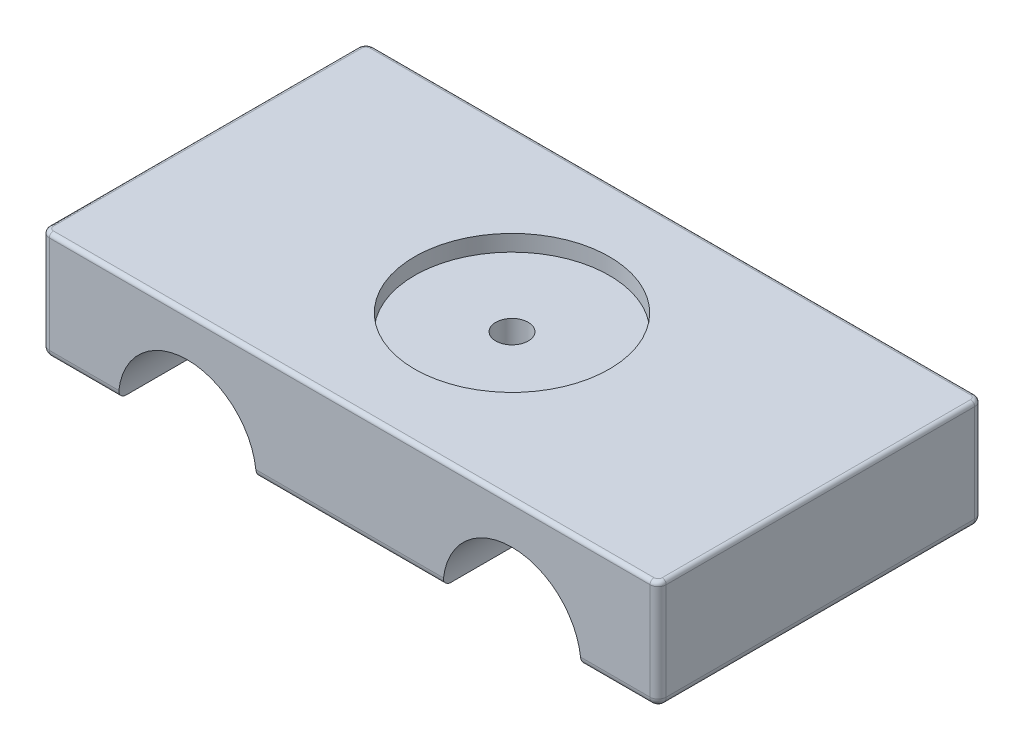
from build123d import *

# Parameters (mm, degrees)
BOSS_EXTRUDE1_DEPTH = 508
FILLET1_R           = 12.7
SKETCH2_R           = 7.62
CUT_EXTRUDE1_DEPTH  = 132.08
SKETCH3_W           = 265.176
SKETCH3_H           = 455.676
CUT_EXTRUDE2_DEPTH  = 88.9
SKETCH4_W           = 81.026
SKETCH4_H           = 455.676
CUT_EXTRUDE3_DEPTH  = 157.988
SKETCH5_W           = 81.026
SKETCH5_H           = 455.676
CUT_EXTRUDE4_DEPTH  = 72.898
FILLET3_R           = 6.35
SKETCH7_R           = 25.4
CUT_EXTRUDE5_DEPTH  = 76.2
SKETCH8_R           = 152.4
CUT_EXTRUDE6_DEPTH  = 25.4


with BuildPart() as part:
    # Sketch1 → Boss-Extrude1 (new body)
    with BuildSketch(Plane.XY):
        with BuildLine():
            Line((0, 96.4), (0, -40.108885674))
            Line((0, -40.108885674), (0, -62.3))
            ThreePointArc((0, -62.3), (3.719743879, -71.280256121), (12.7, -75))
            Line((12.7, -75), (120.65, -75))
            ThreePointArc((120.65, -75), (228.6, 32.95), (336.55, -75))
            Line((336.55, -75), (628.65, -75))
            ThreePointArc((628.65, -75), (736.6, 32.95), (844.55, -75))
            Line((844.55, -75), (952.5, -75))
            ThreePointArc((952.5, -75), (961.480256121, -71.280256121), (965.2, -62.3))
            Line((965.2, -62.3), (965.2, 25))
            Line((965.2, 25), (965.2, 96.4))
            Line((965.2, 96.4), (0, 96.4))
        make_face()
    extrude(amount=BOSS_EXTRUDE1_DEPTH)

    # Fillet1
    fillet1_edges = [part.edges().sort_by_distance(p)[0] for p in [
        (66.675, -75, 0),
        (3.719743879, -71.280256121, 0),
        (0, 17.05, 0),
        (898.525, -75, 0),
        (961.480256121, -71.280256121, 0),
        (965.2, 17.05, 0),
        (965.2, 17.05, 508),
        (961.480256121, -71.280256121, 508),
        (898.525, -75, 508),
        (482.6, -75, 508),
        (66.675, -75, 508),
        (3.719743879, -71.280256121, 508),
        (0, 17.05, 508),
        (482.6, -75, 0),
    ]]
    fillet(fillet1_edges, radius=FILLET1_R)

    # Sketch2 → Cut-Extrude1 (cut)
    with BuildSketch(Plane.XZ.offset(75)):
        with Locations((228.6, 469.9)):
            Circle(SKETCH2_R)
        with Locations((228.6, 38.1)):
            Circle(SKETCH2_R)
        with Locations((736.6, 469.9)):
            Circle(SKETCH2_R)
        with Locations((736.6, 38.1)):
            Circle(SKETCH2_R)
    extrude(amount=-CUT_EXTRUDE1_DEPTH, mode=Mode.SUBTRACT)

    # Sketch3 → Cut-Extrude2 (cut)
    with BuildSketch(Plane.XZ.offset(75)):
        with Locations((482.6, 254)):
            Rectangle(SKETCH3_W, SKETCH3_H)
    extrude(amount=-CUT_EXTRUDE2_DEPTH, mode=Mode.SUBTRACT)

    # Sketch4 → Cut-Extrude3 (cut)
    with BuildSketch(Plane.XZ.offset(75)):
        with Locations((898.525, 254)):
            Rectangle(SKETCH4_W, SKETCH4_H)
    extrude(amount=-CUT_EXTRUDE3_DEPTH, mode=Mode.SUBTRACT)

    # Sketch5 → Cut-Extrude4 (cut)
    with BuildSketch(Plane.XZ.offset(75)):
        with Locations((66.675, 254)):
            Rectangle(SKETCH5_W, SKETCH5_H)
    extrude(amount=-CUT_EXTRUDE4_DEPTH, mode=Mode.SUBTRACT)

    # Fillet3
    fillet3_edges = [part.edges().sort_by_distance(p)[0] for p in [
        (3.719743879, 96.4, 504.280256121),
        (482.6, 96.4, 508),
        (961.480256121, 96.4, 504.280256121),
        (965.2, 96.4, 254),
        (961.480256121, 96.4, 3.719743879),
        (482.6, 96.4, 0),
        (3.719743879, 96.4, 3.719743879),
        (0, 96.4, 254),
    ]]
    fillet(fillet3_edges, radius=FILLET3_R)

    # Sketch7 → Cut-Extrude5 (cut)
    with BuildSketch(Plane(origin=(0, 96.4, 0), x_dir=(1, 0, 0), z_dir=(0, 1, 0))):
        with Locations((482.6, -254)):
            Circle(SKETCH7_R)
    extrude(amount=-CUT_EXTRUDE5_DEPTH, mode=Mode.SUBTRACT)

    # Sketch8 → Cut-Extrude6 (cut)
    with BuildSketch(Plane(origin=(0, 96.4, 0), x_dir=(1, 0, 0), z_dir=(0, 1, 0))):
        with Locations((482.6, -254)):
            Circle(SKETCH8_R)
    extrude(amount=-CUT_EXTRUDE6_DEPTH, mode=Mode.SUBTRACT)


solid = part.part
